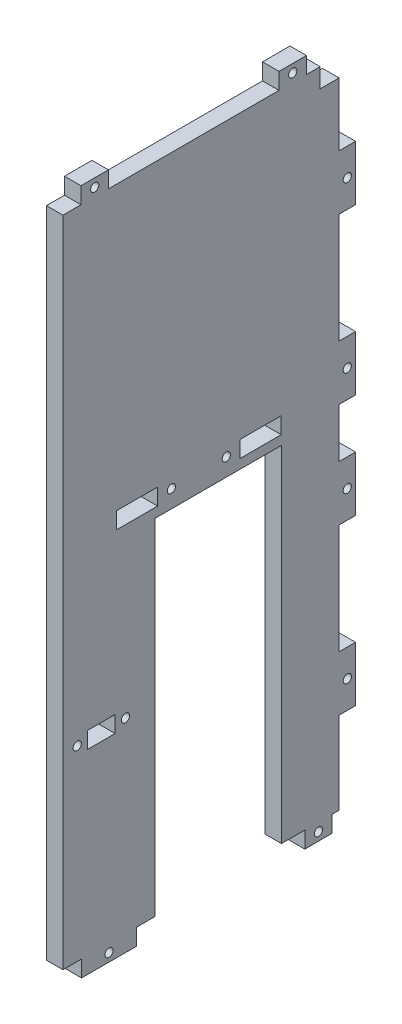
from build123d import *

# Parameters (mm, degrees)
ESQUISSE1_W             = 100.58
ESQUISSE1_H             = 238
ESQUISSE1_W_2           = 10
ESQUISSE1_H_2           = 6
ESQUISSE1_W_3           = 15
BOSS_EXTRU_1_DEPTH      = 6
ESQUISSE3_W             = 20
ESQUISSE3_H             = 6
ESQUISSE3_W_2           = 10
ESQUISSE3_W_3           = 6
ESQUISSE3_H_2           = 20
BOSS_EXTRU_5_DEPTH      = 6
ESQUISSE6_W             = 46
ESQUISSE6_H             = 125.59
ENL_V_MAT_EXTRU_2_DEPTH = 6
ESQUISSE7_W             = 6.88
ESQUISSE7_H             = 7
ENL_V_MAT_EXTRU_3_DEPTH = 6
ESQUISSE8_R             = 1.5
ENL_V_MAT_EXTRU_4_DEPTH = 6


with BuildPart() as part:
    # Esquisse1 → Boss.-Extru.1 (new body)
    with BuildSketch(Plane(origin=(0, 0, 0), x_dir=(0, 0, -1), z_dir=(1, 0, 0))):
        Rectangle(ESQUISSE1_W, ESQUISSE1_H)
        with Locations((-36.29, -51)):
            Rectangle(ESQUISSE1_W_2, ESQUISSE1_H_2, mode=Mode.SUBTRACT)
        with Locations((-23.295, 13)):
            Rectangle(ESQUISSE1_W_3, ESQUISSE1_H_2, mode=Mode.SUBTRACT)
        with Locations((21.705, 13)):
            Rectangle(ESQUISSE1_W_3, ESQUISSE1_H_2, mode=Mode.SUBTRACT)
    extrude(amount=BOSS_EXTRU_1_DEPTH)

    # Esquisse3 → Boss.-Extru.5 (add)
    with BuildSketch(Plane(origin=(6, 0, 0), x_dir=(0, 0, -1), z_dir=(1, 0, 0))):
        with Locations((-33.5, -122)):
            Rectangle(ESQUISSE3_W, ESQUISSE3_H)
        with Locations((42.79, -122)):
            Rectangle(ESQUISSE3_W_2, ESQUISSE3_H)
        with Locations((53.29, 19)):
            Rectangle(ESQUISSE3_W_3, ESQUISSE3_H_2)
        with Locations((53.29, 79)):
            Rectangle(ESQUISSE3_W_3, ESQUISSE3_H_2)
        with Locations((53.29, -79)):
            Rectangle(ESQUISSE3_W_3, ESQUISSE3_H_2)
        with Locations((53.29, -19)):
            Rectangle(ESQUISSE3_W_3, ESQUISSE3_H_2)
        with Locations((33.41, 122)):
            Rectangle(ESQUISSE3_W_2, ESQUISSE3_H)
        with Locations((-38.71, 122)):
            Rectangle(ESQUISSE3_W_2, ESQUISSE3_H)
    extrude(amount=-BOSS_EXTRU_5_DEPTH)

    # Esquisse6 → Enlèv. mat.-Extru.2 (cut)
    with BuildSketch(Plane(origin=(6, 0, 0), x_dir=(0, 0, -1), z_dir=(1, 0, 0))):
        with Locations((6.29, -56.205)):
            Rectangle(ESQUISSE6_W, ESQUISSE6_H)
    extrude(amount=-ENL_V_MAT_EXTRU_2_DEPTH, mode=Mode.SUBTRACT)

    # Esquisse7 → Enlèv. mat.-Extru.3 (cut)
    with BuildSketch(Plane.ZY):
        with Locations((-46.85, 115.5)):
            Rectangle(ESQUISSE7_W, ESQUISSE7_H)
    extrude(amount=-ENL_V_MAT_EXTRU_3_DEPTH, mode=Mode.SUBTRACT)

    # Esquisse8 → Enlèv. mat.-Extru.4 (cut)
    with BuildSketch(Plane.ZY):
        with Locations((-9.205, 13)):
            Circle(ESQUISSE8_R)
        with Locations((10.795, 13)):
            Circle(ESQUISSE8_R)
        with Locations((27.5, -51)):
            Circle(ESQUISSE8_R)
        with Locations((45.08, -51)):
            Circle(ESQUISSE8_R)
        with Locations((38.71, 122)):
            Circle(ESQUISSE8_R)
        with Locations((-33.41, 122)):
            Circle(ESQUISSE8_R)
        with Locations((33.5, -122)):
            Circle(ESQUISSE8_R)
        with Locations((-53.29, 79)):
            Circle(ESQUISSE8_R)
        with Locations((-42.79, -122)):
            Circle(ESQUISSE8_R)
        with Locations((-53.29, 19)):
            Circle(ESQUISSE8_R)
        with Locations((-53.29, -79)):
            Circle(ESQUISSE8_R)
        with Locations((-53.29, -19)):
            Circle(ESQUISSE8_R)
    extrude(amount=-ENL_V_MAT_EXTRU_4_DEPTH, mode=Mode.SUBTRACT)


solid = part.part
